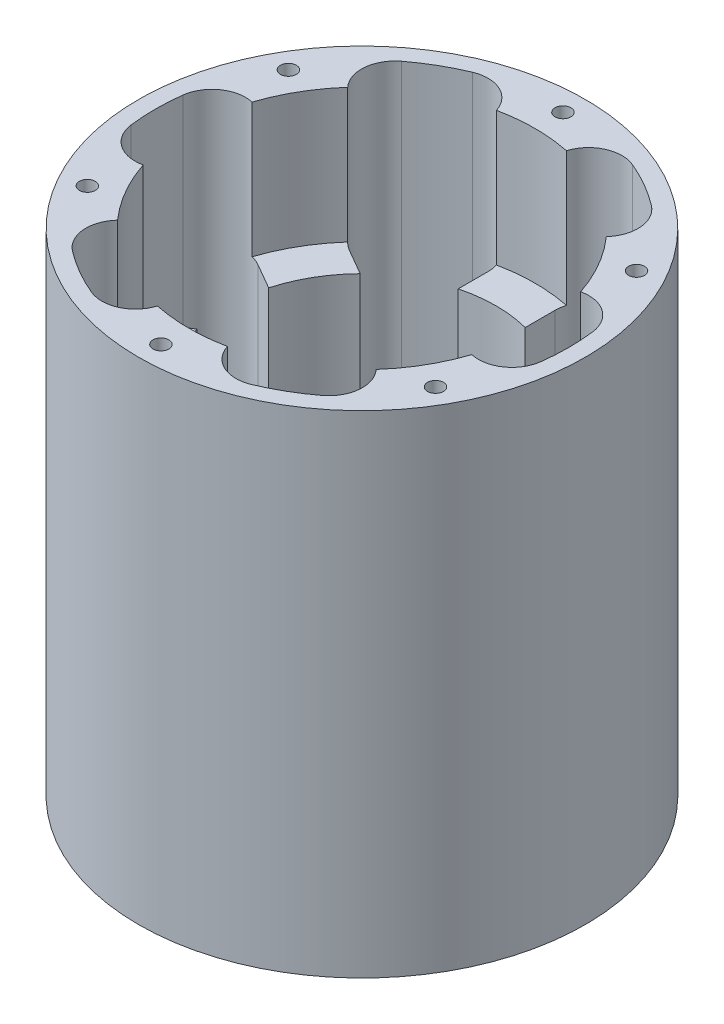
from build123d import *

# Parameters (mm, degrees)
SKETCH1_R             = 31.75
SKETCH1_R_2           = 19.05
BOSS_EXTRUDE1_DEPTH   = 34.925
SKETCH2_R             = 24.60625
CUT_EXTRUDE1_DEPTH    = 19.05
CUT_EXTRUDE2_START    = -30.48
SKETCH3_R             = 24.60625
CUT_EXTRUDE2_DEPTH    = 30.48
F_4_40_TAPPED_HOLE1_D = 2.2606
CUT_EXTRUDE3_DEPTH    = 84.037024874
FILLET1_R             = 4.7625


with BuildPart() as part:
    # Sketch1 → Boss-Extrude1 (new, symmetric)
    with BuildSketch(Plane(origin=(0, 0, 0), x_dir=(1, 0, 0), z_dir=(0, 1, 0))):
        with Locations(Location((0, 0, 0), (0, 0, 270))):
            Circle(SKETCH1_R)
        with Locations(Location((0, 0, 0), (0, 0, 270))):
            Circle(SKETCH1_R_2, mode=Mode.SUBTRACT)
    extrude(amount=BOSS_EXTRUDE1_DEPTH, both=True)

    # Sketch2 → Cut-Extrude1 (cut)
    with BuildSketch(Plane(origin=(0, 34.925, 0), x_dir=(1, 0, 0), z_dir=(0, 1, 0))):
        with Locations(Location((0, 0, 0), (0, 0, 270))):
            Circle(SKETCH2_R)
    extrude(amount=-CUT_EXTRUDE1_DEPTH, mode=Mode.SUBTRACT)

    # Sketch3 → Cut-Extrude2 (cut)
    with BuildSketch(Plane.XZ.offset(34.925).offset(CUT_EXTRUDE2_START)):
        with Locations(Location((0, 0, 0), (0, 0, 90))):
            Circle(SKETCH3_R)
    extrude(amount=CUT_EXTRUDE2_DEPTH, mode=Mode.SUBTRACT)

    # #4-40 Tapped Hole1 (through all)
    with Locations(Plane(origin=(0, 34.925, 0), x_dir=(-1, 0, 0), z_dir=(0, 1, 0))):
        with Locations((0, 28.575), (24.746675913, 14.2875), (24.746675913, -14.2875), (0, -28.575), (-24.746675913, -14.2875), (-24.746675913, 14.2875)):
            Hole(F_4_40_TAPPED_HOLE1_D / 2)

    # Sketch7 → Cut-Extrude3 (cut, through all)
    with BuildSketch(Plane.XZ.offset(34.925)):
        with BuildLine():
            Line((4.7625, 18.445083186), (4.7625, 28.980028818))
            ThreePointArc((4.7625, 28.980028818), (14.684375, 25.434083577), (22.716191159, 18.614460395))
            Line((22.716191159, 18.614460395), (13.592660614, 13.346987579))
            ThreePointArc((13.592660614, 13.346987579), (9.525, 16.497783942), (4.7625, 18.445083186))
        make_face()
        with BuildLine():
            Line((-4.7625, 18.445083186), (-4.7625, 28.980028818))
            ThreePointArc((-4.7625, 28.980028818), (-14.684375, 25.434083577), (-22.716191159, 18.614460395))
            Line((-22.716191159, 18.614460395), (-13.592660614, 13.346987579))
            ThreePointArc((-13.592660614, 13.346987579), (-9.525, 16.497783942), (-4.7625, 18.445083186))
        make_face()
        with BuildLine():
            Line((18.355160614, 5.098095608), (27.478691159, 10.365568424))
            ThreePointArc((27.478691159, 10.365568424), (29.36875, 0), (27.478691159, -10.365568424))
            Line((27.478691159, -10.365568424), (18.355160614, -5.098095608))
            ThreePointArc((18.355160614, -5.098095608), (19.05, 0), (18.355160614, 5.098095608))
        make_face()
        with BuildLine():
            Line((13.592660614, -13.346987579), (22.716191159, -18.614460395))
            ThreePointArc((22.716191159, -18.614460395), (14.684375, -25.434083577), (4.7625, -28.980028818))
            Line((4.7625, -28.980028818), (4.7625, -18.445083186))
            ThreePointArc((4.7625, -18.445083186), (9.525, -16.497783942), (13.592660614, -13.346987579))
        make_face()
        with BuildLine():
            Line((-4.7625, -18.445083186), (-4.7625, -28.980028818))
            ThreePointArc((-4.7625, -28.980028818), (-14.684375, -25.434083577), (-22.716191159, -18.614460395))
            Line((-22.716191159, -18.614460395), (-13.592660614, -13.346987579))
            ThreePointArc((-13.592660614, -13.346987579), (-9.525, -16.497783942), (-4.7625, -18.445083186))
        make_face()
        with BuildLine():
            Line((-18.355160614, -5.098095608), (-27.478691159, -10.365568424))
            ThreePointArc((-27.478691159, -10.365568424), (-29.36875, 0), (-27.478691159, 10.365568424))
            Line((-27.478691159, 10.365568424), (-18.355160614, 5.098095608))
            ThreePointArc((-18.355160614, 5.098095608), (-19.05, 0), (-18.355160614, -5.098095608))
        make_face()
    extrude(amount=-CUT_EXTRUDE3_DEPTH, mode=Mode.SUBTRACT)

    # Fillet1
    # the kernel refuses this fillet: 4.7625 mm, written as the material it adds along each edge
    with BuildSketch(Plane(origin=(-22.716191159, -34.925, -18.614460395), x_dir=(0.7199844339670162, 0, -0.6939902123554736), z_dir=(0, 1, 0))) as fillet1_piece_1_section:
        with BuildLine():
            CenterArc((6.316741848, -4.729773415), FILLET1_R, 83.279222892, 112.773972401)
            Line((1.739953769, -6.04674613), (0, 0))
            ThreePointArc((0, 0), (3.437050711, 0.201813943), (6.874101423, 0))
        make_face()
    fillet1_piece_1 = extrude(amount=69.85, mode=Mode.PRIVATE)
    fillet1_piece_1 = fillet1_piece_1 - Plane(origin=(0, -19.685, 0), x_dir=(0, 0, 1), z_dir=(0, 1, 0)) * Cylinder(24.60625, 168, mode=Mode.PRIVATE)
    fillet1_piece_1 = split(fillet1_piece_1, bisect_by=Plane(origin=(-20.423711164, -4.445, -19.15519975), z_dir=(0, -1, 0)), keep=Keep.TOP, mode=Mode.PRIVATE)
    add(fillet1_piece_1)
    with BuildSketch(Plane(origin=(-22.716191159, -34.925, -18.614460395), x_dir=(0.7199844339670162, 0, -0.6939902123554736), z_dir=(0, 1, 0))) as fillet1_piece_2_section:
        with BuildLine():
            CenterArc((6.316741848, -4.729773415), FILLET1_R, 83.279222892, 112.773972401)
            Line((1.739953769, -6.04674613), (0, 0))
            ThreePointArc((0, 0), (3.437050711, 0.201813943), (6.874101423, 0))
        make_face()
    fillet1_piece_2 = extrude(amount=69.85, mode=Mode.PRIVATE)
    fillet1_piece_2 = fillet1_piece_2 - Plane(origin=(0, 5.715, 0), x_dir=(0, 0, 1), z_dir=(0, 1, 0)) * Cylinder(24.60625, 168, mode=Mode.PRIVATE)
    fillet1_piece_2 = split(fillet1_piece_2, bisect_by=Plane(origin=(-20.423711164, -4.445, -19.15519975), z_dir=(0, 1, 0)), keep=Keep.TOP, mode=Mode.PRIVATE)
    fillet1_piece_2 = split(fillet1_piece_2, bisect_by=Plane(origin=(-20.423711164, 15.875, -19.15519975), z_dir=(0, -1, 0)), keep=Keep.TOP, mode=Mode.PRIVATE)
    add(fillet1_piece_2)
    with BuildSketch(Plane(origin=(-22.716191159, -34.925, -18.614460395), x_dir=(0.7199844339670162, 0, -0.6939902123554736), z_dir=(0, 1, 0))) as fillet1_piece_3_section:
        with BuildLine():
            CenterArc((6.316741848, -4.729773415), FILLET1_R, 83.279222892, 112.773972401)
            Line((1.739953769, -6.04674613), (0, 0))
            ThreePointArc((0, 0), (3.437050711, 0.201813943), (6.874101423, 0))
        make_face()
    fillet1_piece_3 = extrude(amount=69.85, mode=Mode.PRIVATE)
    fillet1_piece_3 = fillet1_piece_3 & Plane(origin=(0, 5.715, 0), x_dir=(0, 0, 1), z_dir=(0, 1, 0)) * Cylinder(24.60625, 168, mode=Mode.PRIVATE)
    fillet1_piece_3 = split(fillet1_piece_3, bisect_by=Plane(origin=(-18.02768706, -4.445, -15.907673241), z_dir=(0, 1, 0)), keep=Keep.TOP, mode=Mode.PRIVATE)
    fillet1_piece_3 = split(fillet1_piece_3, bisect_by=Plane(origin=(-18.02768706, 15.875, -15.907673241), z_dir=(0, -1, 0)), keep=Keep.TOP, mode=Mode.PRIVATE)
    add(fillet1_piece_3)
    with BuildSketch(Plane(origin=(-22.716191159, -34.925, -18.614460395), x_dir=(0.7199844339670162, 0, -0.6939902123554736), z_dir=(0, 1, 0))) as fillet1_piece_4_section:
        with BuildLine():
            CenterArc((6.316741848, -4.729773415), FILLET1_R, 83.279222892, 112.773972401)
            Line((1.739953769, -6.04674613), (0, 0))
            ThreePointArc((0, 0), (3.437050711, 0.201813943), (6.874101423, 0))
        make_face()
    fillet1_piece_4 = extrude(amount=69.85, mode=Mode.PRIVATE)
    fillet1_piece_4 = fillet1_piece_4 - Plane(origin=(0, 25.4, 0), x_dir=(0, 0, 1), z_dir=(0, 1, 0)) * Cylinder(24.60625, 168, mode=Mode.PRIVATE)
    fillet1_piece_4 = split(fillet1_piece_4, bisect_by=Plane(origin=(-20.423711164, 15.875, -19.15519975), z_dir=(0, 1, 0)), keep=Keep.TOP, mode=Mode.PRIVATE)
    add(fillet1_piece_4)
    with BuildSketch(Plane(origin=(-4.7625, -34.925, -28.980028818), x_dir=(0, 0, 1), z_dir=(0, 1, 0))) as fillet1_piece_5_section:
        with BuildLine():
            CenterArc((6.292104408, -4.7625), FILLET1_R, 90, 112.773972401)
            ThreePointArc((1.900893231, -6.606048387), (0.756502333, -3.358831743), (0, 0))
            Line((0, 0), (6.292104408, 0))
        make_face()
    fillet1_piece_5 = extrude(amount=69.85, mode=Mode.PRIVATE)
    fillet1_piece_5 = split(fillet1_piece_5, bisect_by=Plane(origin=(-6.377034016, -4.445, -27.265052582), z_dir=(0, -1, 0)), keep=Keep.TOP, mode=Mode.PRIVATE)
    fillet1_piece_5 = fillet1_piece_5 - Plane(origin=(0, -19.685, 0), x_dir=(0, 0, 1), z_dir=(0, 1, 0)) * Cylinder(24.60625, 167, mode=Mode.PRIVATE)
    add(fillet1_piece_5)
    with BuildSketch(Plane(origin=(-4.7625, -34.925, -28.980028818), x_dir=(0, 0, 1), z_dir=(0, 1, 0))) as fillet1_piece_6_section:
        with BuildLine():
            CenterArc((6.292104408, -4.7625), FILLET1_R, 90, 112.773972401)
            ThreePointArc((1.900893231, -6.606048387), (0.756502333, -3.358831743), (0, 0))
            Line((0, 0), (6.292104408, 0))
        make_face()
    fillet1_piece_6 = extrude(amount=69.85, mode=Mode.PRIVATE)
    fillet1_piece_6 = split(fillet1_piece_6, bisect_by=Plane(origin=(-4.762605612, 15.875, -23.566271586), z_dir=(0, -1, 0)), keep=Keep.TOP, mode=Mode.PRIVATE)
    fillet1_piece_6 = split(fillet1_piece_6, bisect_by=Plane(origin=(-4.762605612, -4.445, -23.566271586), z_dir=(0, 1, 0)), keep=Keep.TOP, mode=Mode.PRIVATE)
    fillet1_piece_6 = fillet1_piece_6 & Plane(origin=(0, 5.715, 0), x_dir=(0, 0, 1), z_dir=(0, 1, 0)) * Cylinder(24.60625, 167, mode=Mode.PRIVATE)
    add(fillet1_piece_6)
    with BuildSketch(Plane(origin=(-4.7625, -34.925, -28.980028818), x_dir=(0, 0, 1), z_dir=(0, 1, 0))) as fillet1_piece_7_section:
        with BuildLine():
            CenterArc((6.292104408, -4.7625), FILLET1_R, 90, 112.773972401)
            ThreePointArc((1.900893231, -6.606048387), (0.756502333, -3.358831743), (0, 0))
            Line((0, 0), (6.292104408, 0))
        make_face()
    fillet1_piece_7 = extrude(amount=69.85, mode=Mode.PRIVATE)
    fillet1_piece_7 = split(fillet1_piece_7, bisect_by=Plane(origin=(-6.377034016, 15.875, -27.265052582), z_dir=(0, -1, 0)), keep=Keep.TOP, mode=Mode.PRIVATE)
    fillet1_piece_7 = split(fillet1_piece_7, bisect_by=Plane(origin=(-6.377034016, -4.445, -27.265052582), z_dir=(0, 1, 0)), keep=Keep.TOP, mode=Mode.PRIVATE)
    fillet1_piece_7 = fillet1_piece_7 - Plane(origin=(0, 5.715, 0), x_dir=(0, 0, 1), z_dir=(0, 1, 0)) * Cylinder(24.60625, 167, mode=Mode.PRIVATE)
    add(fillet1_piece_7)
    with BuildSketch(Plane(origin=(-4.7625, -34.925, -28.980028818), x_dir=(0, 0, 1), z_dir=(0, 1, 0))) as fillet1_piece_8_section:
        with BuildLine():
            CenterArc((6.292104408, -4.7625), FILLET1_R, 90, 112.773972401)
            ThreePointArc((1.900893231, -6.606048387), (0.756502333, -3.358831743), (0, 0))
            Line((0, 0), (6.292104408, 0))
        make_face()
    fillet1_piece_8 = extrude(amount=69.85, mode=Mode.PRIVATE)
    fillet1_piece_8 = split(fillet1_piece_8, bisect_by=Plane(origin=(-6.377034016, 15.875, -27.265052582), z_dir=(0, 1, 0)), keep=Keep.TOP, mode=Mode.PRIVATE)
    fillet1_piece_8 = fillet1_piece_8 - Plane(origin=(0, 25.4, 0), x_dir=(0, 0, 1), z_dir=(0, 1, 0)) * Cylinder(24.60625, 167, mode=Mode.PRIVATE)
    add(fillet1_piece_8)
    with BuildSketch(Plane(origin=(4.7625, -34.925, -28.980028818), x_dir=(0.9610053708611043, 0, 0.2765297039670629), z_dir=(0, 1, 0))) as fillet1_piece_9_section:
        with BuildLine():
            CenterArc((6.316741848, -4.729773415), FILLET1_R, 83.279222892, 112.773972401)
            Line((1.739953769, -6.04674613), (0, 0))
            ThreePointArc((0, 0), (3.437050711, 0.201813943), (6.874101423, 0))
        make_face()
    fillet1_piece_9 = extrude(amount=69.85, mode=Mode.PRIVATE)
    fillet1_piece_9 = fillet1_piece_9 - Plane(origin=(0, -19.685, 0), x_dir=(0, 0, 1), z_dir=(0, 1, 0)) * Cylinder(24.60625, 168, mode=Mode.PRIVATE)
    fillet1_piece_9 = split(fillet1_piece_9, bisect_by=Plane(origin=(6.377034016, -4.445, -27.265052582), z_dir=(0, -1, 0)), keep=Keep.TOP, mode=Mode.PRIVATE)
    add(fillet1_piece_9)
    with BuildSketch(Plane(origin=(4.7625, -34.925, -28.980028818), x_dir=(0.9610053708611043, 0, 0.2765297039670629), z_dir=(0, 1, 0))) as fillet1_piece_10_section:
        with BuildLine():
            CenterArc((6.316741848, -4.729773415), FILLET1_R, 83.279222892, 112.773972401)
            Line((1.739953769, -6.04674613), (0, 0))
            ThreePointArc((0, 0), (3.437050711, 0.201813943), (6.874101423, 0))
        make_face()
    fillet1_piece_10 = extrude(amount=69.85, mode=Mode.PRIVATE)
    fillet1_piece_10 = fillet1_piece_10 - Plane(origin=(0, 5.715, 0), x_dir=(0, 0, 1), z_dir=(0, 1, 0)) * Cylinder(24.60625, 168, mode=Mode.PRIVATE)
    fillet1_piece_10 = split(fillet1_piece_10, bisect_by=Plane(origin=(6.377034016, -4.445, -27.265052582), z_dir=(0, 1, 0)), keep=Keep.TOP, mode=Mode.PRIVATE)
    fillet1_piece_10 = split(fillet1_piece_10, bisect_by=Plane(origin=(6.377034016, 15.875, -27.265052582), z_dir=(0, -1, 0)), keep=Keep.TOP, mode=Mode.PRIVATE)
    add(fillet1_piece_10)
    with BuildSketch(Plane(origin=(4.7625, -34.925, -28.980028818), x_dir=(0.9610053708611043, 0, 0.2765297039670629), z_dir=(0, 1, 0))) as fillet1_piece_11_section:
        with BuildLine():
            CenterArc((6.316741848, -4.729773415), FILLET1_R, 83.279222892, 112.773972401)
            Line((1.739953769, -6.04674613), (0, 0))
            ThreePointArc((0, 0), (3.437050711, 0.201813943), (6.874101423, 0))
        make_face()
    fillet1_piece_11 = extrude(amount=69.85, mode=Mode.PRIVATE)
    fillet1_piece_11 = fillet1_piece_11 & Plane(origin=(0, 5.715, 0), x_dir=(0, 0, 1), z_dir=(0, 1, 0)) * Cylinder(24.60625, 168, mode=Mode.PRIVATE)
    fillet1_piece_11 = split(fillet1_piece_11, bisect_by=Plane(origin=(4.762605612, -4.445, -23.566271586), z_dir=(0, 1, 0)), keep=Keep.TOP, mode=Mode.PRIVATE)
    fillet1_piece_11 = split(fillet1_piece_11, bisect_by=Plane(origin=(4.762605612, 15.875, -23.566271586), z_dir=(0, -1, 0)), keep=Keep.TOP, mode=Mode.PRIVATE)
    add(fillet1_piece_11)
    with BuildSketch(Plane(origin=(4.7625, -34.925, -28.980028818), x_dir=(0.9610053708611043, 0, 0.2765297039670629), z_dir=(0, 1, 0))) as fillet1_piece_12_section:
        with BuildLine():
            CenterArc((6.316741848, -4.729773415), FILLET1_R, 83.279222892, 112.773972401)
            Line((1.739953769, -6.04674613), (0, 0))
            ThreePointArc((0, 0), (3.437050711, 0.201813943), (6.874101423, 0))
        make_face()
    fillet1_piece_12 = extrude(amount=69.85, mode=Mode.PRIVATE)
    fillet1_piece_12 = fillet1_piece_12 - Plane(origin=(0, 25.4, 0), x_dir=(0, 0, 1), z_dir=(0, 1, 0)) * Cylinder(24.60625, 168, mode=Mode.PRIVATE)
    fillet1_piece_12 = split(fillet1_piece_12, bisect_by=Plane(origin=(6.377034016, 15.875, -27.265052582), z_dir=(0, 1, 0)), keep=Keep.TOP, mode=Mode.PRIVATE)
    add(fillet1_piece_12)
    with BuildSketch(Plane(origin=(22.716191159, -34.925, -18.614460395), x_dir=(-0.8660254037844429, 0, 0.49999999999999245), z_dir=(0, 1, 0))) as fillet1_piece_13_section:
        with BuildLine():
            CenterArc((6.292104408, -4.7625), FILLET1_R, 90, 112.773972401)
            ThreePointArc((1.900893231, -6.606048387), (0.756502333, -3.358831743), (0, 0))
            Line((0, 0), (6.292104408, 0))
        make_face()
    fillet1_piece_13 = extrude(amount=69.85, mode=Mode.PRIVATE)
    fillet1_piece_13 = split(fillet1_piece_13, bisect_by=Plane(origin=(20.423711164, -4.445, -19.15519975), z_dir=(0, -1, 0)), keep=Keep.TOP, mode=Mode.PRIVATE)
    fillet1_piece_13 = fillet1_piece_13 - Plane(origin=(0, -19.685, 0), x_dir=(0, 0, 1), z_dir=(0, 1, 0)) * Cylinder(24.60625, 167, mode=Mode.PRIVATE)
    add(fillet1_piece_13)
    with BuildSketch(Plane(origin=(22.716191159, -34.925, -18.614460395), x_dir=(-0.8660254037844429, 0, 0.49999999999999245), z_dir=(0, 1, 0))) as fillet1_piece_14_section:
        with BuildLine():
            CenterArc((6.292104408, -4.7625), FILLET1_R, 90, 112.773972401)
            ThreePointArc((1.900893231, -6.606048387), (0.756502333, -3.358831743), (0, 0))
            Line((0, 0), (6.292104408, 0))
        make_face()
    fillet1_piece_14 = extrude(amount=69.85, mode=Mode.PRIVATE)
    fillet1_piece_14 = split(fillet1_piece_14, bisect_by=Plane(origin=(18.02768706, 15.875, -15.907673241), z_dir=(0, -1, 0)), keep=Keep.TOP, mode=Mode.PRIVATE)
    fillet1_piece_14 = split(fillet1_piece_14, bisect_by=Plane(origin=(18.02768706, -4.445, -15.907673241), z_dir=(0, 1, 0)), keep=Keep.TOP, mode=Mode.PRIVATE)
    fillet1_piece_14 = fillet1_piece_14 & Plane(origin=(0, 5.715, 0), x_dir=(0, 0, 1), z_dir=(0, 1, 0)) * Cylinder(24.60625, 167, mode=Mode.PRIVATE)
    add(fillet1_piece_14)
    with BuildSketch(Plane(origin=(22.716191159, -34.925, -18.614460395), x_dir=(-0.8660254037844429, 0, 0.49999999999999245), z_dir=(0, 1, 0))) as fillet1_piece_15_section:
        with BuildLine():
            CenterArc((6.292104408, -4.7625), FILLET1_R, 90, 112.773972401)
            ThreePointArc((1.900893231, -6.606048387), (0.756502333, -3.358831743), (0, 0))
            Line((0, 0), (6.292104408, 0))
        make_face()
    fillet1_piece_15 = extrude(amount=69.85, mode=Mode.PRIVATE)
    fillet1_piece_15 = split(fillet1_piece_15, bisect_by=Plane(origin=(20.423711164, 15.875, -19.15519975), z_dir=(0, -1, 0)), keep=Keep.TOP, mode=Mode.PRIVATE)
    fillet1_piece_15 = split(fillet1_piece_15, bisect_by=Plane(origin=(20.423711164, -4.445, -19.15519975), z_dir=(0, 1, 0)), keep=Keep.TOP, mode=Mode.PRIVATE)
    fillet1_piece_15 = fillet1_piece_15 - Plane(origin=(0, 5.715, 0), x_dir=(0, 0, 1), z_dir=(0, 1, 0)) * Cylinder(24.60625, 167, mode=Mode.PRIVATE)
    add(fillet1_piece_15)
    with BuildSketch(Plane(origin=(22.716191159, -34.925, -18.614460395), x_dir=(-0.8660254037844429, 0, 0.49999999999999245), z_dir=(0, 1, 0))) as fillet1_piece_16_section:
        with BuildLine():
            CenterArc((6.292104408, -4.7625), FILLET1_R, 90, 112.773972401)
            ThreePointArc((1.900893231, -6.606048387), (0.756502333, -3.358831743), (0, 0))
            Line((0, 0), (6.292104408, 0))
        make_face()
    fillet1_piece_16 = extrude(amount=69.85, mode=Mode.PRIVATE)
    fillet1_piece_16 = split(fillet1_piece_16, bisect_by=Plane(origin=(20.423711164, 15.875, -19.15519975), z_dir=(0, 1, 0)), keep=Keep.TOP, mode=Mode.PRIVATE)
    fillet1_piece_16 = fillet1_piece_16 - Plane(origin=(0, 25.4, 0), x_dir=(0, 0, 1), z_dir=(0, 1, 0)) * Cylinder(24.60625, 167, mode=Mode.PRIVATE)
    add(fillet1_piece_16)
    with BuildSketch(Plane(origin=(27.478691159, -34.925, -10.365568424), x_dir=(0.24102093689407753, 0, 0.9705199163225353), z_dir=(0, 1, 0))) as fillet1_piece_17_section:
        with BuildLine():
            CenterArc((6.316741848, -4.729773415), FILLET1_R, 83.279222892, 112.773972401)
            Line((1.739953769, -6.04674613), (0, 0))
            ThreePointArc((0, 0), (3.437050711, 0.201813943), (6.874101423, 0))
        make_face()
    fillet1_piece_17 = extrude(amount=69.85, mode=Mode.PRIVATE)
    fillet1_piece_17 = fillet1_piece_17 - Plane(origin=(0, -19.685, 0), x_dir=(0, 0, 1), z_dir=(0, 1, 0)) * Cylinder(24.60625, 168, mode=Mode.PRIVATE)
    fillet1_piece_17 = split(fillet1_piece_17, bisect_by=Plane(origin=(26.80074518, -4.445, -8.109852833), z_dir=(0, -1, 0)), keep=Keep.TOP, mode=Mode.PRIVATE)
    add(fillet1_piece_17)
    with BuildSketch(Plane(origin=(27.478691159, -34.925, -10.365568424), x_dir=(0.24102093689407753, 0, 0.9705199163225353), z_dir=(0, 1, 0))) as fillet1_piece_18_section:
        with BuildLine():
            CenterArc((6.316741848, -4.729773415), FILLET1_R, 83.279222892, 112.773972401)
            Line((1.739953769, -6.04674613), (0, 0))
            ThreePointArc((0, 0), (3.437050711, 0.201813943), (6.874101423, 0))
        make_face()
    fillet1_piece_18 = extrude(amount=69.85, mode=Mode.PRIVATE)
    fillet1_piece_18 = fillet1_piece_18 - Plane(origin=(0, 5.715, 0), x_dir=(0, 0, 1), z_dir=(0, 1, 0)) * Cylinder(24.60625, 168, mode=Mode.PRIVATE)
    fillet1_piece_18 = split(fillet1_piece_18, bisect_by=Plane(origin=(26.80074518, -4.445, -8.109852833), z_dir=(0, 1, 0)), keep=Keep.TOP, mode=Mode.PRIVATE)
    fillet1_piece_18 = split(fillet1_piece_18, bisect_by=Plane(origin=(26.80074518, 15.875, -8.109852833), z_dir=(0, -1, 0)), keep=Keep.TOP, mode=Mode.PRIVATE)
    add(fillet1_piece_18)
    with BuildSketch(Plane(origin=(27.478691159, -34.925, -10.365568424), x_dir=(0.24102093689407753, 0, 0.9705199163225353), z_dir=(0, 1, 0))) as fillet1_piece_19_section:
        with BuildLine():
            CenterArc((6.316741848, -4.729773415), FILLET1_R, 83.279222892, 112.773972401)
            Line((1.739953769, -6.04674613), (0, 0))
            ThreePointArc((0, 0), (3.437050711, 0.201813943), (6.874101423, 0))
        make_face()
    fillet1_piece_19 = extrude(amount=69.85, mode=Mode.PRIVATE)
    fillet1_piece_19 = fillet1_piece_19 & Plane(origin=(0, 5.715, 0), x_dir=(0, 0, 1), z_dir=(0, 1, 0)) * Cylinder(24.60625, 168, mode=Mode.PRIVATE)
    fillet1_piece_19 = split(fillet1_piece_19, bisect_by=Plane(origin=(22.790292672, -4.445, -7.658598345), z_dir=(0, 1, 0)), keep=Keep.TOP, mode=Mode.PRIVATE)
    fillet1_piece_19 = split(fillet1_piece_19, bisect_by=Plane(origin=(22.790292672, 15.875, -7.658598345), z_dir=(0, -1, 0)), keep=Keep.TOP, mode=Mode.PRIVATE)
    add(fillet1_piece_19)
    with BuildSketch(Plane(origin=(27.478691159, -34.925, -10.365568424), x_dir=(0.24102093689407753, 0, 0.9705199163225353), z_dir=(0, 1, 0))) as fillet1_piece_20_section:
        with BuildLine():
            CenterArc((6.316741848, -4.729773415), FILLET1_R, 83.279222892, 112.773972401)
            Line((1.739953769, -6.04674613), (0, 0))
            ThreePointArc((0, 0), (3.437050711, 0.201813943), (6.874101423, 0))
        make_face()
    fillet1_piece_20 = extrude(amount=69.85, mode=Mode.PRIVATE)
    fillet1_piece_20 = fillet1_piece_20 - Plane(origin=(0, 25.4, 0), x_dir=(0, 0, 1), z_dir=(0, 1, 0)) * Cylinder(24.60625, 168, mode=Mode.PRIVATE)
    fillet1_piece_20 = split(fillet1_piece_20, bisect_by=Plane(origin=(26.80074518, 15.875, -8.109852833), z_dir=(0, 1, 0)), keep=Keep.TOP, mode=Mode.PRIVATE)
    add(fillet1_piece_20)
    with BuildSketch(Plane(origin=(27.478691159, -34.925, 10.365568424), x_dir=(-0.86602540378444, 0, -0.49999999999999767), z_dir=(0, 1, 0))) as fillet1_piece_21_section:
        with BuildLine():
            CenterArc((6.292104408, -4.7625), FILLET1_R, 90, 112.773972401)
            ThreePointArc((1.900893231, -6.606048387), (0.756502333, -3.358831743), (0, 0))
            Line((0, 0), (6.292104408, 0))
        make_face()
    fillet1_piece_21 = extrude(amount=69.85, mode=Mode.PRIVATE)
    fillet1_piece_21 = split(fillet1_piece_21, bisect_by=Plane(origin=(26.80074518, -4.445, 8.109852833), z_dir=(0, -1, 0)), keep=Keep.TOP, mode=Mode.PRIVATE)
    fillet1_piece_21 = fillet1_piece_21 - Plane(origin=(0, -19.685, 0), x_dir=(0, 0, 1), z_dir=(0, 1, 0)) * Cylinder(24.60625, 167, mode=Mode.PRIVATE)
    add(fillet1_piece_21)
    with BuildSketch(Plane(origin=(27.478691159, -34.925, 10.365568424), x_dir=(-0.86602540378444, 0, -0.49999999999999767), z_dir=(0, 1, 0))) as fillet1_piece_22_section:
        with BuildLine():
            CenterArc((6.292104408, -4.7625), FILLET1_R, 90, 112.773972401)
            ThreePointArc((1.900893231, -6.606048387), (0.756502333, -3.358831743), (0, 0))
            Line((0, 0), (6.292104408, 0))
        make_face()
    fillet1_piece_22 = extrude(amount=69.85, mode=Mode.PRIVATE)
    fillet1_piece_22 = split(fillet1_piece_22, bisect_by=Plane(origin=(22.790292672, 15.875, 7.658598345), z_dir=(0, -1, 0)), keep=Keep.TOP, mode=Mode.PRIVATE)
    fillet1_piece_22 = split(fillet1_piece_22, bisect_by=Plane(origin=(22.790292672, -4.445, 7.658598345), z_dir=(0, 1, 0)), keep=Keep.TOP, mode=Mode.PRIVATE)
    fillet1_piece_22 = fillet1_piece_22 & Plane(origin=(0, 5.715, 0), x_dir=(0, 0, 1), z_dir=(0, 1, 0)) * Cylinder(24.60625, 167, mode=Mode.PRIVATE)
    add(fillet1_piece_22)
    with BuildSketch(Plane(origin=(27.478691159, -34.925, 10.365568424), x_dir=(-0.86602540378444, 0, -0.49999999999999767), z_dir=(0, 1, 0))) as fillet1_piece_23_section:
        with BuildLine():
            CenterArc((6.292104408, -4.7625), FILLET1_R, 90, 112.773972401)
            ThreePointArc((1.900893231, -6.606048387), (0.756502333, -3.358831743), (0, 0))
            Line((0, 0), (6.292104408, 0))
        make_face()
    fillet1_piece_23 = extrude(amount=69.85, mode=Mode.PRIVATE)
    fillet1_piece_23 = split(fillet1_piece_23, bisect_by=Plane(origin=(26.80074518, 15.875, 8.109852833), z_dir=(0, -1, 0)), keep=Keep.TOP, mode=Mode.PRIVATE)
    fillet1_piece_23 = split(fillet1_piece_23, bisect_by=Plane(origin=(26.80074518, -4.445, 8.109852833), z_dir=(0, 1, 0)), keep=Keep.TOP, mode=Mode.PRIVATE)
    fillet1_piece_23 = fillet1_piece_23 - Plane(origin=(0, 5.715, 0), x_dir=(0, 0, 1), z_dir=(0, 1, 0)) * Cylinder(24.60625, 167, mode=Mode.PRIVATE)
    add(fillet1_piece_23)
    with BuildSketch(Plane(origin=(27.478691159, -34.925, 10.365568424), x_dir=(-0.86602540378444, 0, -0.49999999999999767), z_dir=(0, 1, 0))) as fillet1_piece_24_section:
        with BuildLine():
            CenterArc((6.292104408, -4.7625), FILLET1_R, 90, 112.773972401)
            ThreePointArc((1.900893231, -6.606048387), (0.756502333, -3.358831743), (0, 0))
            Line((0, 0), (6.292104408, 0))
        make_face()
    fillet1_piece_24 = extrude(amount=69.85, mode=Mode.PRIVATE)
    fillet1_piece_24 = split(fillet1_piece_24, bisect_by=Plane(origin=(26.80074518, 15.875, 8.109852833), z_dir=(0, 1, 0)), keep=Keep.TOP, mode=Mode.PRIVATE)
    fillet1_piece_24 = fillet1_piece_24 - Plane(origin=(0, 25.4, 0), x_dir=(0, 0, 1), z_dir=(0, 1, 0)) * Cylinder(24.60625, 167, mode=Mode.PRIVATE)
    add(fillet1_piece_24)
    with BuildSketch(Plane(origin=(22.716191159, -34.925, 18.614460395), x_dir=(-0.7199844339670193, 0, 0.6939902123554703), z_dir=(0, 1, 0))) as fillet1_piece_25_section:
        with BuildLine():
            CenterArc((6.316741848, -4.729773415), FILLET1_R, 83.279222892, 112.773972401)
            Line((1.739953769, -6.04674613), (0, 0))
            ThreePointArc((0, 0), (3.437050711, 0.201813943), (6.874101423, 0))
        make_face()
    fillet1_piece_25 = extrude(amount=69.85, mode=Mode.PRIVATE)
    fillet1_piece_25 = fillet1_piece_25 - Plane(origin=(0, -19.685, 0), x_dir=(0, 0, 1), z_dir=(0, 1, 0)) * Cylinder(24.60625, 168, mode=Mode.PRIVATE)
    fillet1_piece_25 = split(fillet1_piece_25, bisect_by=Plane(origin=(20.423711164, -4.445, 19.15519975), z_dir=(0, -1, 0)), keep=Keep.TOP, mode=Mode.PRIVATE)
    add(fillet1_piece_25)
    with BuildSketch(Plane(origin=(22.716191159, -34.925, 18.614460395), x_dir=(-0.7199844339670193, 0, 0.6939902123554703), z_dir=(0, 1, 0))) as fillet1_piece_26_section:
        with BuildLine():
            CenterArc((6.316741848, -4.729773415), FILLET1_R, 83.279222892, 112.773972401)
            Line((1.739953769, -6.04674613), (0, 0))
            ThreePointArc((0, 0), (3.437050711, 0.201813943), (6.874101423, 0))
        make_face()
    fillet1_piece_26 = extrude(amount=69.85, mode=Mode.PRIVATE)
    fillet1_piece_26 = fillet1_piece_26 - Plane(origin=(0, 5.715, 0), x_dir=(0, 0, 1), z_dir=(0, 1, 0)) * Cylinder(24.60625, 168, mode=Mode.PRIVATE)
    fillet1_piece_26 = split(fillet1_piece_26, bisect_by=Plane(origin=(20.423711164, -4.445, 19.15519975), z_dir=(0, 1, 0)), keep=Keep.TOP, mode=Mode.PRIVATE)
    fillet1_piece_26 = split(fillet1_piece_26, bisect_by=Plane(origin=(20.423711164, 15.875, 19.15519975), z_dir=(0, -1, 0)), keep=Keep.TOP, mode=Mode.PRIVATE)
    add(fillet1_piece_26)
    with BuildSketch(Plane(origin=(22.716191159, -34.925, 18.614460395), x_dir=(-0.7199844339670193, 0, 0.6939902123554703), z_dir=(0, 1, 0))) as fillet1_piece_27_section:
        with BuildLine():
            CenterArc((6.316741848, -4.729773415), FILLET1_R, 83.279222892, 112.773972401)
            Line((1.739953769, -6.04674613), (0, 0))
            ThreePointArc((0, 0), (3.437050711, 0.201813943), (6.874101423, 0))
        make_face()
    fillet1_piece_27 = extrude(amount=69.85, mode=Mode.PRIVATE)
    fillet1_piece_27 = fillet1_piece_27 & Plane(origin=(0, 5.715, 0), x_dir=(0, 0, 1), z_dir=(0, 1, 0)) * Cylinder(24.60625, 168, mode=Mode.PRIVATE)
    fillet1_piece_27 = split(fillet1_piece_27, bisect_by=Plane(origin=(18.02768706, -4.445, 15.907673241), z_dir=(0, 1, 0)), keep=Keep.TOP, mode=Mode.PRIVATE)
    fillet1_piece_27 = split(fillet1_piece_27, bisect_by=Plane(origin=(18.02768706, 15.875, 15.907673241), z_dir=(0, -1, 0)), keep=Keep.TOP, mode=Mode.PRIVATE)
    add(fillet1_piece_27)
    with BuildSketch(Plane(origin=(22.716191159, -34.925, 18.614460395), x_dir=(-0.7199844339670193, 0, 0.6939902123554703), z_dir=(0, 1, 0))) as fillet1_piece_28_section:
        with BuildLine():
            CenterArc((6.316741848, -4.729773415), FILLET1_R, 83.279222892, 112.773972401)
            Line((1.739953769, -6.04674613), (0, 0))
            ThreePointArc((0, 0), (3.437050711, 0.201813943), (6.874101423, 0))
        make_face()
    fillet1_piece_28 = extrude(amount=69.85, mode=Mode.PRIVATE)
    fillet1_piece_28 = fillet1_piece_28 - Plane(origin=(0, 25.4, 0), x_dir=(0, 0, 1), z_dir=(0, 1, 0)) * Cylinder(24.60625, 168, mode=Mode.PRIVATE)
    fillet1_piece_28 = split(fillet1_piece_28, bisect_by=Plane(origin=(20.423711164, 15.875, 19.15519975), z_dir=(0, 1, 0)), keep=Keep.TOP, mode=Mode.PRIVATE)
    add(fillet1_piece_28)
    with BuildSketch(Plane(origin=(4.7625, -34.925, 28.980028818), x_dir=(0, 0, -1), z_dir=(0, 1, 0))) as fillet1_piece_29_section:
        with BuildLine():
            CenterArc((6.292104408, -4.7625), FILLET1_R, 90, 112.773972401)
            ThreePointArc((1.900893231, -6.606048387), (0.756502333, -3.358831743), (0, 0))
            Line((0, 0), (6.292104408, 0))
        make_face()
    fillet1_piece_29 = extrude(amount=69.85, mode=Mode.PRIVATE)
    fillet1_piece_29 = split(fillet1_piece_29, bisect_by=Plane(origin=(6.377034016, -4.445, 27.265052582), z_dir=(0, -1, 0)), keep=Keep.TOP, mode=Mode.PRIVATE)
    fillet1_piece_29 = fillet1_piece_29 - Plane(origin=(0, -19.685, 0), x_dir=(0, 0, 1), z_dir=(0, 1, 0)) * Cylinder(24.60625, 167, mode=Mode.PRIVATE)
    add(fillet1_piece_29)
    with BuildSketch(Plane(origin=(4.7625, -34.925, 28.980028818), x_dir=(0, 0, -1), z_dir=(0, 1, 0))) as fillet1_piece_30_section:
        with BuildLine():
            CenterArc((6.292104408, -4.7625), FILLET1_R, 90, 112.773972401)
            ThreePointArc((1.900893231, -6.606048387), (0.756502333, -3.358831743), (0, 0))
            Line((0, 0), (6.292104408, 0))
        make_face()
    fillet1_piece_30 = extrude(amount=69.85, mode=Mode.PRIVATE)
    fillet1_piece_30 = split(fillet1_piece_30, bisect_by=Plane(origin=(4.762605612, -4.445, 23.566271586), z_dir=(0, 1, 0)), keep=Keep.TOP, mode=Mode.PRIVATE)
    fillet1_piece_30 = fillet1_piece_30 & Plane(origin=(0, 5.715, 0), x_dir=(0, 0, 1), z_dir=(0, 1, 0)) * Cylinder(24.60625, 167, mode=Mode.PRIVATE)
    fillet1_piece_30 = split(fillet1_piece_30, bisect_by=Plane(origin=(4.762605612, 15.875, 23.566271586), z_dir=(0, -1, 0)), keep=Keep.TOP, mode=Mode.PRIVATE)
    add(fillet1_piece_30)
    with BuildSketch(Plane(origin=(4.7625, -34.925, 28.980028818), x_dir=(0, 0, -1), z_dir=(0, 1, 0))) as fillet1_piece_31_section:
        with BuildLine():
            CenterArc((6.292104408, -4.7625), FILLET1_R, 90, 112.773972401)
            ThreePointArc((1.900893231, -6.606048387), (0.756502333, -3.358831743), (0, 0))
            Line((0, 0), (6.292104408, 0))
        make_face()
    fillet1_piece_31 = extrude(amount=69.85, mode=Mode.PRIVATE)
    fillet1_piece_31 = split(fillet1_piece_31, bisect_by=Plane(origin=(6.377034016, -4.445, 27.265052582), z_dir=(0, 1, 0)), keep=Keep.TOP, mode=Mode.PRIVATE)
    fillet1_piece_31 = fillet1_piece_31 - Plane(origin=(0, 5.715, 0), x_dir=(0, 0, 1), z_dir=(0, 1, 0)) * Cylinder(24.60625, 167, mode=Mode.PRIVATE)
    fillet1_piece_31 = split(fillet1_piece_31, bisect_by=Plane(origin=(6.377034016, 15.875, 27.265052582), z_dir=(0, -1, 0)), keep=Keep.TOP, mode=Mode.PRIVATE)
    add(fillet1_piece_31)
    with BuildSketch(Plane(origin=(4.7625, -34.925, 28.980028818), x_dir=(0, 0, -1), z_dir=(0, 1, 0))) as fillet1_piece_32_section:
        with BuildLine():
            CenterArc((6.292104408, -4.7625), FILLET1_R, 90, 112.773972401)
            ThreePointArc((1.900893231, -6.606048387), (0.756502333, -3.358831743), (0, 0))
            Line((0, 0), (6.292104408, 0))
        make_face()
    fillet1_piece_32 = extrude(amount=69.85, mode=Mode.PRIVATE)
    fillet1_piece_32 = fillet1_piece_32 - Plane(origin=(0, 25.4, 0), x_dir=(0, 0, 1), z_dir=(0, 1, 0)) * Cylinder(24.60625, 167, mode=Mode.PRIVATE)
    fillet1_piece_32 = split(fillet1_piece_32, bisect_by=Plane(origin=(6.377034016, 15.875, 27.265052582), z_dir=(0, 1, 0)), keep=Keep.TOP, mode=Mode.PRIVATE)
    add(fillet1_piece_32)
    with BuildSketch(Plane(origin=(-4.7625, -34.925, 28.980028818), x_dir=(-0.9610053708611035, 0, -0.27652970396706567), z_dir=(0, 1, 0))) as fillet1_piece_33_section:
        with BuildLine():
            CenterArc((6.316741848, -4.729773415), FILLET1_R, 83.279222892, 112.773972401)
            Line((1.739953769, -6.04674613), (0, 0))
            ThreePointArc((0, 0), (3.437050711, 0.201813943), (6.874101423, 0))
        make_face()
    fillet1_piece_33 = extrude(amount=69.85, mode=Mode.PRIVATE)
    fillet1_piece_33 = fillet1_piece_33 - Plane(origin=(0, -19.685, 0), x_dir=(0, 0, 1), z_dir=(0, 1, 0)) * Cylinder(24.60625, 168, mode=Mode.PRIVATE)
    fillet1_piece_33 = split(fillet1_piece_33, bisect_by=Plane(origin=(-6.377034016, -4.445, 27.265052582), z_dir=(0, -1, 0)), keep=Keep.TOP, mode=Mode.PRIVATE)
    add(fillet1_piece_33)
    with BuildSketch(Plane(origin=(-4.7625, -34.925, 28.980028818), x_dir=(-0.9610053708611035, 0, -0.27652970396706567), z_dir=(0, 1, 0))) as fillet1_piece_34_section:
        with BuildLine():
            CenterArc((6.316741848, -4.729773415), FILLET1_R, 83.279222892, 112.773972401)
            Line((1.739953769, -6.04674613), (0, 0))
            ThreePointArc((0, 0), (3.437050711, 0.201813943), (6.874101423, 0))
        make_face()
    fillet1_piece_34 = extrude(amount=69.85, mode=Mode.PRIVATE)
    fillet1_piece_34 = split(fillet1_piece_34, bisect_by=Plane(origin=(-6.377034016, 15.875, 27.265052582), z_dir=(0, -1, 0)), keep=Keep.TOP, mode=Mode.PRIVATE)
    fillet1_piece_34 = fillet1_piece_34 - Plane(origin=(0, 5.715, 0), x_dir=(0, 0, 1), z_dir=(0, 1, 0)) * Cylinder(24.60625, 168, mode=Mode.PRIVATE)
    fillet1_piece_34 = split(fillet1_piece_34, bisect_by=Plane(origin=(-6.377034016, -4.445, 27.265052582), z_dir=(0, 1, 0)), keep=Keep.TOP, mode=Mode.PRIVATE)
    add(fillet1_piece_34)
    with BuildSketch(Plane(origin=(-4.7625, -34.925, 28.980028818), x_dir=(-0.9610053708611035, 0, -0.27652970396706567), z_dir=(0, 1, 0))) as fillet1_piece_35_section:
        with BuildLine():
            CenterArc((6.316741848, -4.729773415), FILLET1_R, 83.279222892, 112.773972401)
            Line((1.739953769, -6.04674613), (0, 0))
            ThreePointArc((0, 0), (3.437050711, 0.201813943), (6.874101423, 0))
        make_face()
    fillet1_piece_35 = extrude(amount=69.85, mode=Mode.PRIVATE)
    fillet1_piece_35 = split(fillet1_piece_35, bisect_by=Plane(origin=(-4.762605612, 15.875, 23.566271586), z_dir=(0, -1, 0)), keep=Keep.TOP, mode=Mode.PRIVATE)
    fillet1_piece_35 = fillet1_piece_35 & Plane(origin=(0, 5.715, 0), x_dir=(0, 0, 1), z_dir=(0, 1, 0)) * Cylinder(24.60625, 168, mode=Mode.PRIVATE)
    fillet1_piece_35 = split(fillet1_piece_35, bisect_by=Plane(origin=(-4.762605612, -4.445, 23.566271586), z_dir=(0, 1, 0)), keep=Keep.TOP, mode=Mode.PRIVATE)
    add(fillet1_piece_35)
    with BuildSketch(Plane(origin=(-4.7625, -34.925, 28.980028818), x_dir=(-0.9610053708611035, 0, -0.27652970396706567), z_dir=(0, 1, 0))) as fillet1_piece_36_section:
        with BuildLine():
            CenterArc((6.316741848, -4.729773415), FILLET1_R, 83.279222892, 112.773972401)
            Line((1.739953769, -6.04674613), (0, 0))
            ThreePointArc((0, 0), (3.437050711, 0.201813943), (6.874101423, 0))
        make_face()
    fillet1_piece_36 = extrude(amount=69.85, mode=Mode.PRIVATE)
    fillet1_piece_36 = split(fillet1_piece_36, bisect_by=Plane(origin=(-6.377034016, 15.875, 27.265052582), z_dir=(0, 1, 0)), keep=Keep.TOP, mode=Mode.PRIVATE)
    fillet1_piece_36 = fillet1_piece_36 - Plane(origin=(0, 25.4, 0), x_dir=(0, 0, 1), z_dir=(0, 1, 0)) * Cylinder(24.60625, 168, mode=Mode.PRIVATE)
    add(fillet1_piece_36)
    with BuildSketch(Plane(origin=(-22.716191159, -34.925, 18.614460395), x_dir=(0.8660254037844327, 0, -0.5000000000000101), z_dir=(0, 1, 0))) as fillet1_piece_37_section:
        with BuildLine():
            CenterArc((6.292104408, -4.7625), FILLET1_R, 90, 112.773972401)
            ThreePointArc((1.900893231, -6.606048387), (0.756502333, -3.358831743), (0, 0))
            Line((0, 0), (6.292104408, 0))
        make_face()
    fillet1_piece_37 = extrude(amount=69.85, mode=Mode.PRIVATE)
    fillet1_piece_37 = split(fillet1_piece_37, bisect_by=Plane(origin=(-20.423711164, -4.445, 19.15519975), z_dir=(0, -1, 0)), keep=Keep.TOP, mode=Mode.PRIVATE)
    fillet1_piece_37 = fillet1_piece_37 - Plane(origin=(0, -19.685, 0), x_dir=(0, 0, 1), z_dir=(0, 1, 0)) * Cylinder(24.60625, 167, mode=Mode.PRIVATE)
    add(fillet1_piece_37)
    with BuildSketch(Plane(origin=(-22.716191159, -34.925, 18.614460395), x_dir=(0.8660254037844327, 0, -0.5000000000000101), z_dir=(0, 1, 0))) as fillet1_piece_38_section:
        with BuildLine():
            CenterArc((6.292104408, -4.7625), FILLET1_R, 90, 112.773972401)
            ThreePointArc((1.900893231, -6.606048387), (0.756502333, -3.358831743), (0, 0))
            Line((0, 0), (6.292104408, 0))
        make_face()
    fillet1_piece_38 = extrude(amount=69.85, mode=Mode.PRIVATE)
    fillet1_piece_38 = split(fillet1_piece_38, bisect_by=Plane(origin=(-18.02768706, 15.875, 15.907673241), z_dir=(0, -1, 0)), keep=Keep.TOP, mode=Mode.PRIVATE)
    fillet1_piece_38 = split(fillet1_piece_38, bisect_by=Plane(origin=(-18.02768706, -4.445, 15.907673241), z_dir=(0, 1, 0)), keep=Keep.TOP, mode=Mode.PRIVATE)
    fillet1_piece_38 = fillet1_piece_38 & Plane(origin=(0, 5.715, 0), x_dir=(0, 0, 1), z_dir=(0, 1, 0)) * Cylinder(24.60625, 167, mode=Mode.PRIVATE)
    add(fillet1_piece_38)
    with BuildSketch(Plane(origin=(-22.716191159, -34.925, 18.614460395), x_dir=(0.8660254037844327, 0, -0.5000000000000101), z_dir=(0, 1, 0))) as fillet1_piece_39_section:
        with BuildLine():
            CenterArc((6.292104408, -4.7625), FILLET1_R, 90, 112.773972401)
            ThreePointArc((1.900893231, -6.606048387), (0.756502333, -3.358831743), (0, 0))
            Line((0, 0), (6.292104408, 0))
        make_face()
    fillet1_piece_39 = extrude(amount=69.85, mode=Mode.PRIVATE)
    fillet1_piece_39 = split(fillet1_piece_39, bisect_by=Plane(origin=(-20.423711164, 15.875, 19.15519975), z_dir=(0, -1, 0)), keep=Keep.TOP, mode=Mode.PRIVATE)
    fillet1_piece_39 = split(fillet1_piece_39, bisect_by=Plane(origin=(-20.423711164, -4.445, 19.15519975), z_dir=(0, 1, 0)), keep=Keep.TOP, mode=Mode.PRIVATE)
    fillet1_piece_39 = fillet1_piece_39 - Plane(origin=(0, 5.715, 0), x_dir=(0, 0, 1), z_dir=(0, 1, 0)) * Cylinder(24.60625, 167, mode=Mode.PRIVATE)
    add(fillet1_piece_39)
    with BuildSketch(Plane(origin=(-22.716191159, -34.925, 18.614460395), x_dir=(0.8660254037844327, 0, -0.5000000000000101), z_dir=(0, 1, 0))) as fillet1_piece_40_section:
        with BuildLine():
            CenterArc((6.292104408, -4.7625), FILLET1_R, 90, 112.773972401)
            ThreePointArc((1.900893231, -6.606048387), (0.756502333, -3.358831743), (0, 0))
            Line((0, 0), (6.292104408, 0))
        make_face()
    fillet1_piece_40 = extrude(amount=69.85, mode=Mode.PRIVATE)
    fillet1_piece_40 = split(fillet1_piece_40, bisect_by=Plane(origin=(-20.423711164, 15.875, 19.15519975), z_dir=(0, 1, 0)), keep=Keep.TOP, mode=Mode.PRIVATE)
    fillet1_piece_40 = fillet1_piece_40 - Plane(origin=(0, 25.4, 0), x_dir=(0, 0, 1), z_dir=(0, 1, 0)) * Cylinder(24.60625, 167, mode=Mode.PRIVATE)
    add(fillet1_piece_40)
    with BuildSketch(Plane(origin=(-27.478691159, -34.925, -10.365568424), x_dir=(0.8660254037844384, 0, 0.5000000000000004), z_dir=(0, 1, 0))) as fillet1_piece_41_section:
        with BuildLine():
            CenterArc((6.292104408, -4.7625), FILLET1_R, 90, 112.773972401)
            ThreePointArc((1.900893231, -6.606048387), (0.756502333, -3.358831743), (0, 0))
            Line((0, 0), (6.292104408, 0))
        make_face()
    fillet1_piece_41 = extrude(amount=69.85, mode=Mode.PRIVATE)
    fillet1_piece_41 = split(fillet1_piece_41, bisect_by=Plane(origin=(-26.80074518, -4.445, -8.109852833), z_dir=(0, -1, 0)), keep=Keep.TOP, mode=Mode.PRIVATE)
    fillet1_piece_41 = fillet1_piece_41 - Plane(origin=(0, -19.685, 0), x_dir=(0, 0, 1), z_dir=(0, 1, 0)) * Cylinder(24.60625, 167, mode=Mode.PRIVATE)
    add(fillet1_piece_41)
    with BuildSketch(Plane(origin=(-27.478691159, -34.925, -10.365568424), x_dir=(0.8660254037844384, 0, 0.5000000000000004), z_dir=(0, 1, 0))) as fillet1_piece_42_section:
        with BuildLine():
            CenterArc((6.292104408, -4.7625), FILLET1_R, 90, 112.773972401)
            ThreePointArc((1.900893231, -6.606048387), (0.756502333, -3.358831743), (0, 0))
            Line((0, 0), (6.292104408, 0))
        make_face()
    fillet1_piece_42 = extrude(amount=69.85, mode=Mode.PRIVATE)
    fillet1_piece_42 = split(fillet1_piece_42, bisect_by=Plane(origin=(-22.790292672, 15.875, -7.658598345), z_dir=(0, -1, 0)), keep=Keep.TOP, mode=Mode.PRIVATE)
    fillet1_piece_42 = split(fillet1_piece_42, bisect_by=Plane(origin=(-22.790292672, -4.445, -7.658598345), z_dir=(0, 1, 0)), keep=Keep.TOP, mode=Mode.PRIVATE)
    fillet1_piece_42 = fillet1_piece_42 & Plane(origin=(0, 5.715, 0), x_dir=(0, 0, 1), z_dir=(0, 1, 0)) * Cylinder(24.60625, 167, mode=Mode.PRIVATE)
    add(fillet1_piece_42)
    with BuildSketch(Plane(origin=(-27.478691159, -34.925, -10.365568424), x_dir=(0.8660254037844384, 0, 0.5000000000000004), z_dir=(0, 1, 0))) as fillet1_piece_43_section:
        with BuildLine():
            CenterArc((6.292104408, -4.7625), FILLET1_R, 90, 112.773972401)
            ThreePointArc((1.900893231, -6.606048387), (0.756502333, -3.358831743), (0, 0))
            Line((0, 0), (6.292104408, 0))
        make_face()
    fillet1_piece_43 = extrude(amount=69.85, mode=Mode.PRIVATE)
    fillet1_piece_43 = split(fillet1_piece_43, bisect_by=Plane(origin=(-26.80074518, 15.875, -8.109852833), z_dir=(0, -1, 0)), keep=Keep.TOP, mode=Mode.PRIVATE)
    fillet1_piece_43 = split(fillet1_piece_43, bisect_by=Plane(origin=(-26.80074518, -4.445, -8.109852833), z_dir=(0, 1, 0)), keep=Keep.TOP, mode=Mode.PRIVATE)
    fillet1_piece_43 = fillet1_piece_43 - Plane(origin=(0, 5.715, 0), x_dir=(0, 0, 1), z_dir=(0, 1, 0)) * Cylinder(24.60625, 167, mode=Mode.PRIVATE)
    add(fillet1_piece_43)
    with BuildSketch(Plane(origin=(-27.478691159, -34.925, -10.365568424), x_dir=(0.8660254037844384, 0, 0.5000000000000004), z_dir=(0, 1, 0))) as fillet1_piece_44_section:
        with BuildLine():
            CenterArc((6.292104408, -4.7625), FILLET1_R, 90, 112.773972401)
            ThreePointArc((1.900893231, -6.606048387), (0.756502333, -3.358831743), (0, 0))
            Line((0, 0), (6.292104408, 0))
        make_face()
    fillet1_piece_44 = extrude(amount=69.85, mode=Mode.PRIVATE)
    fillet1_piece_44 = split(fillet1_piece_44, bisect_by=Plane(origin=(-26.80074518, 15.875, -8.109852833), z_dir=(0, 1, 0)), keep=Keep.TOP, mode=Mode.PRIVATE)
    fillet1_piece_44 = fillet1_piece_44 - Plane(origin=(0, 25.4, 0), x_dir=(0, 0, 1), z_dir=(0, 1, 0)) * Cylinder(24.60625, 167, mode=Mode.PRIVATE)
    add(fillet1_piece_44)
    with BuildSketch(Plane(origin=(-27.478691159, -34.925, 10.365568424), x_dir=(-0.2410209368940963, 0, -0.9705199163225308), z_dir=(0, 1, 0))) as fillet1_piece_45_section:
        with BuildLine():
            CenterArc((6.316741848, -4.729773415), FILLET1_R, 83.279222892, 112.773972401)
            Line((1.739953769, -6.04674613), (0, 0))
            ThreePointArc((0, 0), (3.437050711, 0.201813943), (6.874101423, 0))
        make_face()
    fillet1_piece_45 = extrude(amount=69.85, mode=Mode.PRIVATE)
    fillet1_piece_45 = fillet1_piece_45 - Plane(origin=(0, -19.685, 0), x_dir=(0, 0, 1), z_dir=(0, 1, 0)) * Cylinder(24.60625, 168, mode=Mode.PRIVATE)
    fillet1_piece_45 = split(fillet1_piece_45, bisect_by=Plane(origin=(-26.80074518, -4.445, 8.109852833), z_dir=(0, -1, 0)), keep=Keep.TOP, mode=Mode.PRIVATE)
    add(fillet1_piece_45)
    with BuildSketch(Plane(origin=(-27.478691159, -34.925, 10.365568424), x_dir=(-0.2410209368940963, 0, -0.9705199163225308), z_dir=(0, 1, 0))) as fillet1_piece_46_section:
        with BuildLine():
            CenterArc((6.316741848, -4.729773415), FILLET1_R, 83.279222892, 112.773972401)
            Line((1.739953769, -6.04674613), (0, 0))
            ThreePointArc((0, 0), (3.437050711, 0.201813943), (6.874101423, 0))
        make_face()
    fillet1_piece_46 = extrude(amount=69.85, mode=Mode.PRIVATE)
    fillet1_piece_46 = fillet1_piece_46 - Plane(origin=(0, 5.715, 0), x_dir=(0, 0, 1), z_dir=(0, 1, 0)) * Cylinder(24.60625, 168, mode=Mode.PRIVATE)
    fillet1_piece_46 = split(fillet1_piece_46, bisect_by=Plane(origin=(-26.80074518, -4.445, 8.109852833), z_dir=(0, 1, 0)), keep=Keep.TOP, mode=Mode.PRIVATE)
    fillet1_piece_46 = split(fillet1_piece_46, bisect_by=Plane(origin=(-26.80074518, 15.875, 8.109852833), z_dir=(0, -1, 0)), keep=Keep.TOP, mode=Mode.PRIVATE)
    add(fillet1_piece_46)
    with BuildSketch(Plane(origin=(-27.478691159, -34.925, 10.365568424), x_dir=(-0.2410209368940963, 0, -0.9705199163225308), z_dir=(0, 1, 0))) as fillet1_piece_47_section:
        with BuildLine():
            CenterArc((6.316741848, -4.729773415), FILLET1_R, 83.279222892, 112.773972401)
            Line((1.739953769, -6.04674613), (0, 0))
            ThreePointArc((0, 0), (3.437050711, 0.201813943), (6.874101423, 0))
        make_face()
    fillet1_piece_47 = extrude(amount=69.85, mode=Mode.PRIVATE)
    fillet1_piece_47 = fillet1_piece_47 & Plane(origin=(0, 5.715, 0), x_dir=(0, 0, 1), z_dir=(0, 1, 0)) * Cylinder(24.60625, 168, mode=Mode.PRIVATE)
    fillet1_piece_47 = split(fillet1_piece_47, bisect_by=Plane(origin=(-22.790292672, -4.445, 7.658598345), z_dir=(0, 1, 0)), keep=Keep.TOP, mode=Mode.PRIVATE)
    fillet1_piece_47 = split(fillet1_piece_47, bisect_by=Plane(origin=(-22.790292672, 15.875, 7.658598345), z_dir=(0, -1, 0)), keep=Keep.TOP, mode=Mode.PRIVATE)
    add(fillet1_piece_47)
    with BuildSketch(Plane(origin=(-27.478691159, -34.925, 10.365568424), x_dir=(-0.2410209368940963, 0, -0.9705199163225308), z_dir=(0, 1, 0))) as fillet1_piece_48_section:
        with BuildLine():
            CenterArc((6.316741848, -4.729773415), FILLET1_R, 83.279222892, 112.773972401)
            Line((1.739953769, -6.04674613), (0, 0))
            ThreePointArc((0, 0), (3.437050711, 0.201813943), (6.874101423, 0))
        make_face()
    fillet1_piece_48 = extrude(amount=69.85, mode=Mode.PRIVATE)
    fillet1_piece_48 = fillet1_piece_48 - Plane(origin=(0, 25.4, 0), x_dir=(0, 0, 1), z_dir=(0, 1, 0)) * Cylinder(24.60625, 168, mode=Mode.PRIVATE)
    fillet1_piece_48 = split(fillet1_piece_48, bisect_by=Plane(origin=(-26.80074518, 15.875, 8.109852833), z_dir=(0, 1, 0)), keep=Keep.TOP, mode=Mode.PRIVATE)
    add(fillet1_piece_48)


solid = part.part
